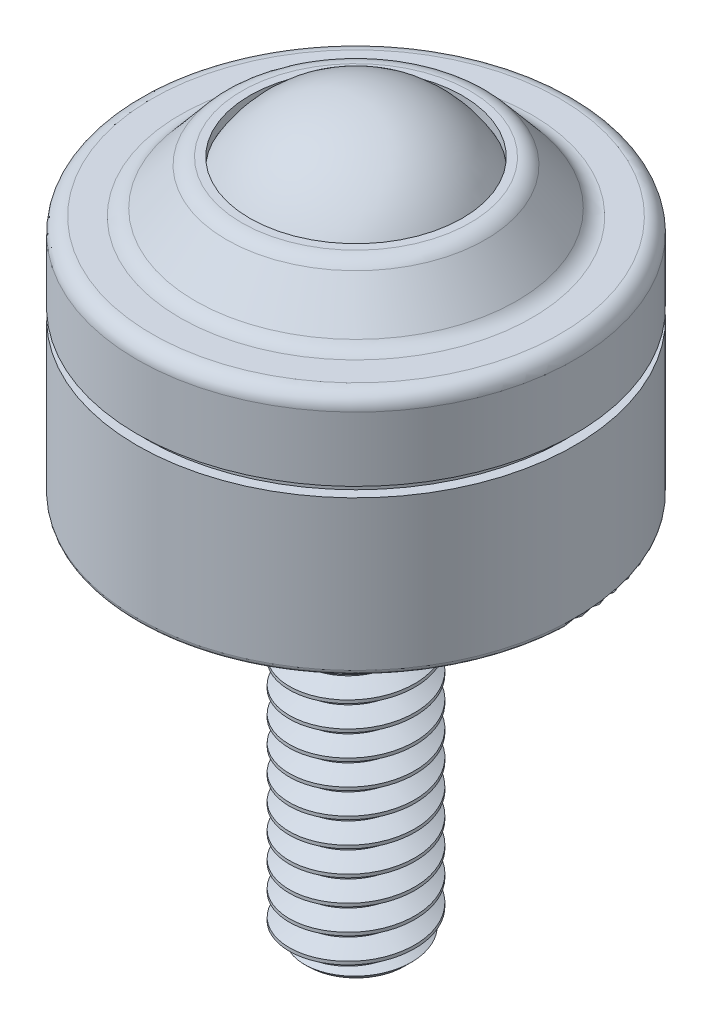
from build123d import *

# Parameters (mm, degrees)
FILLET1_R        = 0.25
FILLET2_R        = 1
SKETCH4_W        = 3.175
SKETCH4_H        = 19.3
CHAMFER1_SIZE    = 0.75
CUT_SWEEP1_PITCH = 1.27


# Read off the part's stored shape, not the designer's step: Split1
with BuildPart() as part:
    # Sketch2 → Revolve1 (revolve)
    with BuildSketch(Plane.XY):
        with BuildLine():
            Line((0, 17.5), (0, 5.1))
            ThreePointArc((0, 5.1), (-6.2, 11.3), (0, 17.5))
        make_face()
    revolve(axis=Axis((0, 0, 0), (0, 1, 0)))


with BuildPart() as body_2:
    # Sketch3 → Revolve3 (revolve)
    with BuildSketch(Plane.XY, mode=Mode.PRIVATE) as revolve3_sk:
        with BuildLine():
            Line((0, 0), (11.05, 0))
            Line((11.05, 0), (11.05, 7.8))
            Line((11.05, 7.8), (10.55, 7.8))
            Line((10.55, 7.8), (10.55, 11.8))
            Line((10.55, 11.8), (8.184741902, 11.8))
            ThreePointArc((8.184741902, 11.8), (5.972436689, 5.681281285), (0, 3.1))
            Line((0, 3.1), (0, 0))
        make_face()
    revolve(revolve3_sk.sketch.rotate(Axis((0, 0, 0), (0, 1, 0)), 90), axis=Axis((0, 0, 0), (0, 1, 0)))

    # Fillet1
    fillet1_edges = [body_2.edges().sort_by_distance(p)[0] for p in [
        (0, 0, 11.05),
        (0, 11.8, 10.55),
    ]]
    fillet(fillet1_edges, radius=FILLET1_R)

    # Sketch4 → Revolve2 (revolve)
    with BuildSketch(Plane.XY, mode=Mode.PRIVATE) as revolve2_sk:
        with Locations((1.5875, -9.65)):
            Rectangle(SKETCH4_W, SKETCH4_H)
    revolve(revolve2_sk.sketch.rotate(Axis((0, 0, 0), (0, -1, 0)), 90), axis=Axis((0, 0, 0), (0, -1, 0)))

    # Chamfer1
    chamfer1_edges = [body_2.edges().sort_by_distance(p)[0] for p in [
        (0, -19.3, -3.175),
    ]]
    chamfer(chamfer1_edges, length=CHAMFER1_SIZE)


with BuildPart() as body_3:
    # Sketch14 → Revolve-Thin2 (revolve)
    with BuildSketch(Plane.XY, mode=Mode.PRIVATE) as revolve_thin2_sk:
        with BuildLine():
            Line((10.55, 8.3), (10.55, 11.55))
            ThreePointArc((10.55, 11.55), (10.476776695, 11.726776695), (10.3, 11.8))
            Line((10.3, 11.8), (8.184741902, 11.8))
            Line((8.184741902, 11.8), (6.003082861, 14.4))
            Line((6.003082861, 14.4), (5.369357503, 14.4))
            Line((5.369357503, 14.4), (5.369357503, 14.9))
            Line((5.369357503, 14.9), (6.23623669, 14.9))
            Line((6.23623669, 14.9), (8.417895731, 12.3))
            Line((8.417895731, 12.3), (10.3, 12.3))
            ThreePointArc((10.3, 12.3), (10.830330086, 12.080330086), (11.05, 11.55))
            Line((11.05, 11.55), (11.05, 8.3))
            Line((11.05, 8.3), (10.55, 8.3))
        make_face()
    revolve(revolve_thin2_sk.sketch.rotate(Axis((0, 0, 0), (0, 1, 0)), 90), axis=Axis((0, 0, 0), (0, 1, 0)))

    # Fillet2
    fillet2_edges = [body_3.edges().sort_by_distance(p)[0] for p in [
        (0, 14.9, 6.23623669),
        (0, 12.3, 8.417895731),
    ]]
    fillet(fillet2_edges, radius=FILLET2_R)


with BuildPart() as body_4:
    # Split1: the piece on the far side of the plane
    add(body_2.part)
    split(bisect_by=Plane(origin=(0, 0, 0), x_dir=(1, 0, 0), z_dir=(0, 1, 0)), keep=Keep.BOTTOM)

    # Cut-Sweep1: the profile of Sketch9 screwed along a right-hand helix of 16.19685 turns, 8 arcs to a turn; built about Z, then put on its axis
    cut_sweep1_z = Axis((0, 0, 0), (0, 0, 1))
    cut_sweep1_corners = [(3.243740766, 0, -1.1509375), (3.243740766, 0, 0.0396875), (2.350110803, 0, -0.47625), (2.350110803, 0, -0.635)]
    with BuildLine(mode=Mode.PRIVATE) as cut_sweep1_profile:
        Line(cut_sweep1_corners[0], cut_sweep1_corners[1])
        Line(cut_sweep1_corners[1], cut_sweep1_corners[2])
        Line(cut_sweep1_corners[2], cut_sweep1_corners[3])
        Line(cut_sweep1_corners[3], cut_sweep1_corners[0])
    cut_sweep1_cap = Face(cut_sweep1_profile.wire())
    cut_sweep1_turn_angles = [0, 22.5, 45, 67.5, 90, 112.5, 135, 157.5, 180, 202.5, 225, 247.5, 270, 292.5, 315, 337.5, 360]
    cut_sweep1_turn_weights = [1, 0.9238795325112867, 1, 0.9238795325112867, 1, 0.9238795325112867, 1, 0.9238795325112867, 1, 0.9238795325112867, 1, 0.9238795325112867, 1, 0.9238795325112867, 1, 0.9238795325112867, 1]
    cut_sweep1_turn_rails = [Edge.make_bspline([Vector(p[0], p[1], 0).rotate(cut_sweep1_z, cut_sweep1_turn_angles[k]) / cut_sweep1_turn_weights[k] + Vector(0, 0, p[2] + CUT_SWEEP1_PITCH * cut_sweep1_turn_angles[k] / 360) for k in range(17)], [0, 0, 0, 1, 1, 2, 2, 3, 3, 4, 4, 5, 5, 6, 6, 7, 7, 8, 8, 8], 2, cut_sweep1_turn_weights) for p in cut_sweep1_corners]
    cut_sweep1_turn_sides = [Face.make_surface_from_curves(cut_sweep1_turn_rails[p[0]], cut_sweep1_turn_rails[p[1]]) for p in [(0, 1), (1, 2), (2, 3), (3, 0)]]
    cut_sweep1_turn = Solid(Shell([*cut_sweep1_turn_sides, cut_sweep1_cap, cut_sweep1_cap.rotate(cut_sweep1_z, 360).moved(Location((0, 0, CUT_SWEEP1_PITCH * 360 / 360)))]))
    cut_sweep1_last_angles = [5760, 5782.5, 5805, 5817.933070866, 5830.866141732]
    cut_sweep1_last_weights = [1, 0.9238795325112867, 1, 0.974632172862654, 1]
    cut_sweep1_last_rails = [Edge.make_bspline([Vector(p[0], p[1], 0).rotate(cut_sweep1_z, cut_sweep1_last_angles[k]) / cut_sweep1_last_weights[k] + Vector(0, 0, p[2] + CUT_SWEEP1_PITCH * cut_sweep1_last_angles[k] / 360) for k in range(5)], [0, 0, 0, 1, 1, 2, 2, 2], 2, cut_sweep1_last_weights) for p in cut_sweep1_corners]
    cut_sweep1_last_sides = [Face.make_surface_from_curves(cut_sweep1_last_rails[p[0]], cut_sweep1_last_rails[p[1]]) for p in [(0, 1), (1, 2), (2, 3), (3, 0)]]
    cut_sweep1_last = Solid(Shell([*cut_sweep1_last_sides, cut_sweep1_cap.rotate(cut_sweep1_z, 5760).moved(Location((0, 0, CUT_SWEEP1_PITCH * 5760 / 360))), cut_sweep1_cap.rotate(cut_sweep1_z, 5830.866141732).moved(Location((0, 0, CUT_SWEEP1_PITCH * 5830.866141732 / 360)))]))
    cut_sweep1_each = [*[cut_sweep1_turn.moved(Location((0, 0, CUT_SWEEP1_PITCH * i))) for i in range(16)], cut_sweep1_last]
    add(Plane(origin=(0, -19.3, 0), x_dir=(1, 0, 0), z_dir=(0, 1, 0)) * Compound([cut_sweep1_each[i] for i in range(0, 17, 2)]), mode=Mode.SUBTRACT)
    add(Plane(origin=(0, -19.3, 0), x_dir=(1, 0, 0), z_dir=(0, 1, 0)) * Compound([cut_sweep1_each[i] for i in range(1, 17, 2)]), mode=Mode.SUBTRACT)


with BuildPart() as body_2_1:
    add(body_2.part)

    # Split1
    split(bisect_by=Plane(origin=(0, 0, 0), x_dir=(1, 0, 0), z_dir=(0, 1, 0)), keep=Keep.TOP)


with BuildPart() as body_4_1:
    add(body_4.part)

    # Combine1: union body 2
    add(body_2_1.part)


solid = Compound([part.part, body_3.part, body_4_1.part])
